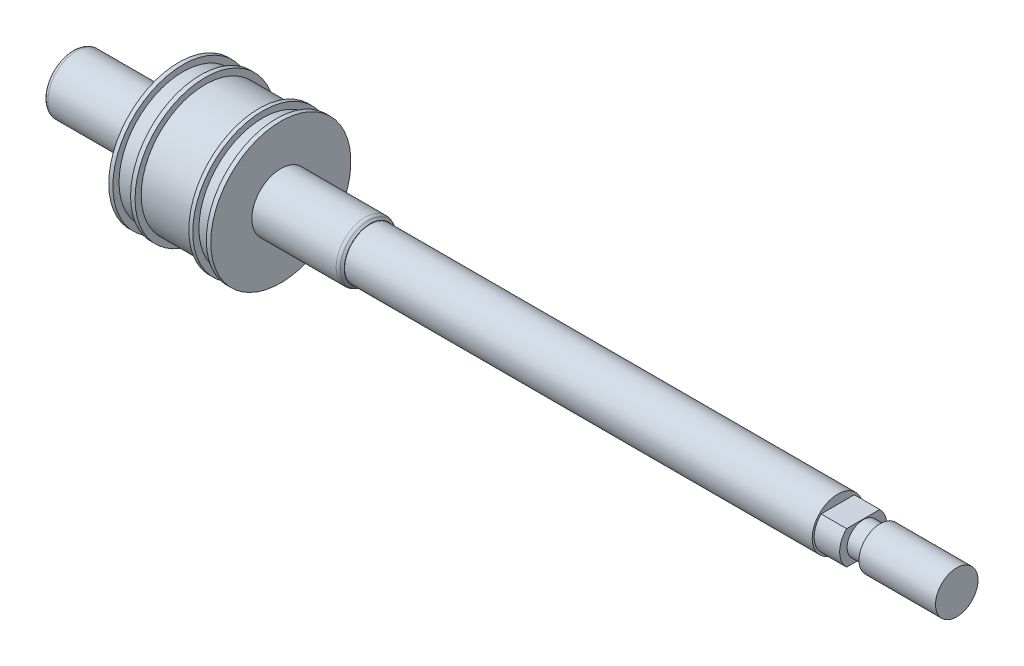
from build123d import *

# Parameters (mm, degrees)
SKETCH1_R      = 6
EXTRUDE1_DEPTH = 180
EXTRUDE2_DEPTH = 6
SKETCH3_R      = 3.788307544
EXTRUDE3_DEPTH = 4
SKETCH4_R      = 5
EXTRUDE4_DEPTH = 18
SKETCH8_R      = 6.825455514
EXTRUDE5_DEPTH = 70
CHAMFER1_SIZE  = 0.75
FILLET1_R      = 1
FILLET2_R      = 1
SKETCH9_R      = 16.479367075
EXTRUDE6_DEPTH = 24
SKETCH10_W     = 4.15677911
SKETCH10_H     = 1.813063228
SKETCH10_W_2   = 12.647221546
SKETCH10_W_3   = 3.183915914


with BuildPart() as part:
    # Sketch1 → Extrude1 (new body)
    with BuildSketch(Plane(origin=(0, 0, 0), x_dir=(0, 0, -1), z_dir=(1, 0, 0))):
        Circle(SKETCH1_R)
    extrude(amount=EXTRUDE1_DEPTH)

    # Sketch2 → Extrude2 (add)
    with BuildSketch(Plane(origin=(180, 0, 0), x_dir=(0, 0, -1), z_dir=(1, 0, 0))):
        with BuildLine():
            Line((-3.906170554, 3.923966319), (3.906170554, 3.923966319))
            ThreePointArc((3.906170554, 3.923966319), (5.53675718, 0), (3.906170554, -3.923966319))
            Line((3.906170554, -3.923966319), (-3.906170554, -3.923966319))
            ThreePointArc((-3.906170554, -3.923966319), (-5.53675718, 0), (-3.906170554, 3.923966319))
        make_face()
    extrude(amount=EXTRUDE2_DEPTH)

    # Sketch3 → Extrude3 (add)
    with BuildSketch(Plane(origin=(186, 0, 0), x_dir=(0, 0, -1), z_dir=(1, 0, 0))):
        Circle(SKETCH3_R)
    extrude(amount=EXTRUDE3_DEPTH)

    # Sketch4 → Extrude4 (add)
    with BuildSketch(Plane(origin=(190, 0, 0), x_dir=(0, 0, -1), z_dir=(1, 0, 0))):
        Circle(SKETCH4_R)
    extrude(amount=EXTRUDE4_DEPTH)

    # Sketch8 → Extrude5 (add)
    with BuildSketch(Plane.ZY):
        Circle(SKETCH8_R)
    extrude(amount=-EXTRUDE5_DEPTH)

    # Chamfer1
    chamfer1_edges = [part.edges().sort_by_distance(p)[0] for p in [
        (70, 0, -6.825455514),
    ]]
    chamfer(chamfer1_edges, length=CHAMFER1_SIZE)

    # Fillet1
    fillet1_edges = [part.edges().sort_by_distance(p)[0] for p in [
        (69.25, 0, -6.825455514),
    ]]
    fillet(fillet1_edges, radius=FILLET1_R)

    # Fillet2
    fillet2_edges = [part.edges().sort_by_distance(p)[0] for p in [
        (0, 0, -6.825455514),
    ]]
    fillet(fillet2_edges, radius=FILLET2_R)

    # Sketch9 → Extrude6 (add)
    with BuildSketch(Plane.ZY.offset(-25)):
        Circle(SKETCH9_R)
    extrude(amount=-EXTRUDE6_DEPTH)

    # Sketch10 → Cut-Revolve1 (revolve, cut)
    with BuildSketch(Plane(origin=(0, 0, 0), x_dir=(1, 0, 0), z_dir=(0, 1, 0))):
        with Locations((28.051356721, 15.941597894)):
            Rectangle(SKETCH10_W, SKETCH10_H)
        with Locations((37.514662353, 15.941597894)):
            Rectangle(SKETCH10_W_2, SKETCH10_H)
        with Locations((46.358873225, 15.941597894)):
            Rectangle(SKETCH10_W_3, SKETCH10_H)
    revolve(axis=Axis((0, 0, 0), (1, 0, 0)), mode=Mode.SUBTRACT)


solid = part.part
